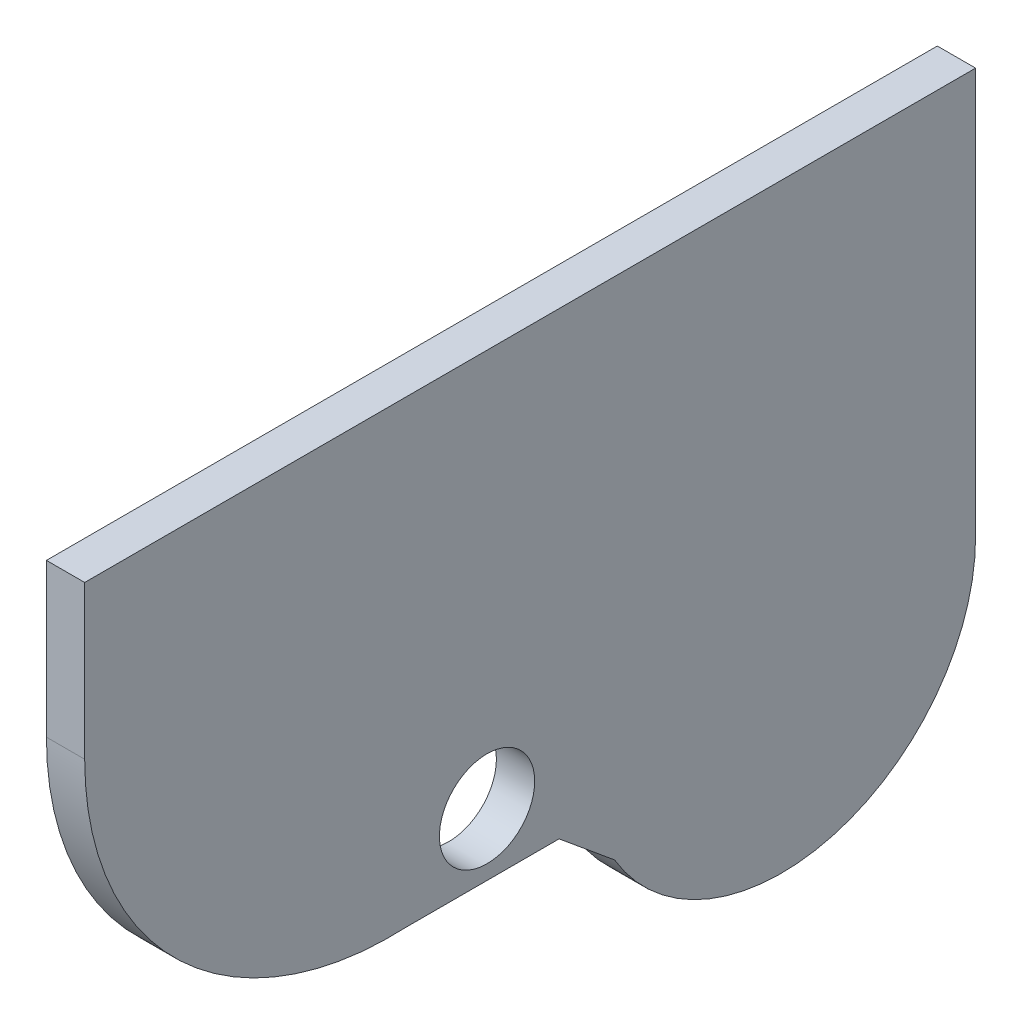
from build123d import *

# Parameters (mm, degrees)
SKETCH1_R           = 7.903770435
BOSS_EXTRUDE1_DEPTH = 6.35


with BuildPart() as part:
    # Sketch1 → Boss-Extrude1 (new body)
    with BuildSketch(Plane(origin=(0, 0, 0), x_dir=(0, 0, -1), z_dir=(1, 0, 0))):
        with BuildLine():
            Line((-53.216160937, 59.584650477), (94.59599113, 59.584650477))
            Line((94.59599113, 59.584650477), (94.59599113, -7.793422186))
            ThreePointArc((94.59599113, -7.793422186), (70.916903018, -38.851030585), (34.697891359, -24.240847568))
            Line((34.697891359, -24.240847568), (25.49878919, -16.615349523))
            Line((25.49878919, -16.615349523), (0.09878919, -16.615349523))
            ThreePointArc((0.09878919, -16.615349523), (-37.4408738, -2.636280755), (-53.216160937, 34.184650477))
            Line((-53.216160937, 34.184650477), (-53.216160937, 59.584650477))
        make_face()
        with Locations((13.539821046, -6.307303718)):
            Circle(SKETCH1_R, mode=Mode.SUBTRACT)
    extrude(amount=BOSS_EXTRUDE1_DEPTH)


solid = part.part
